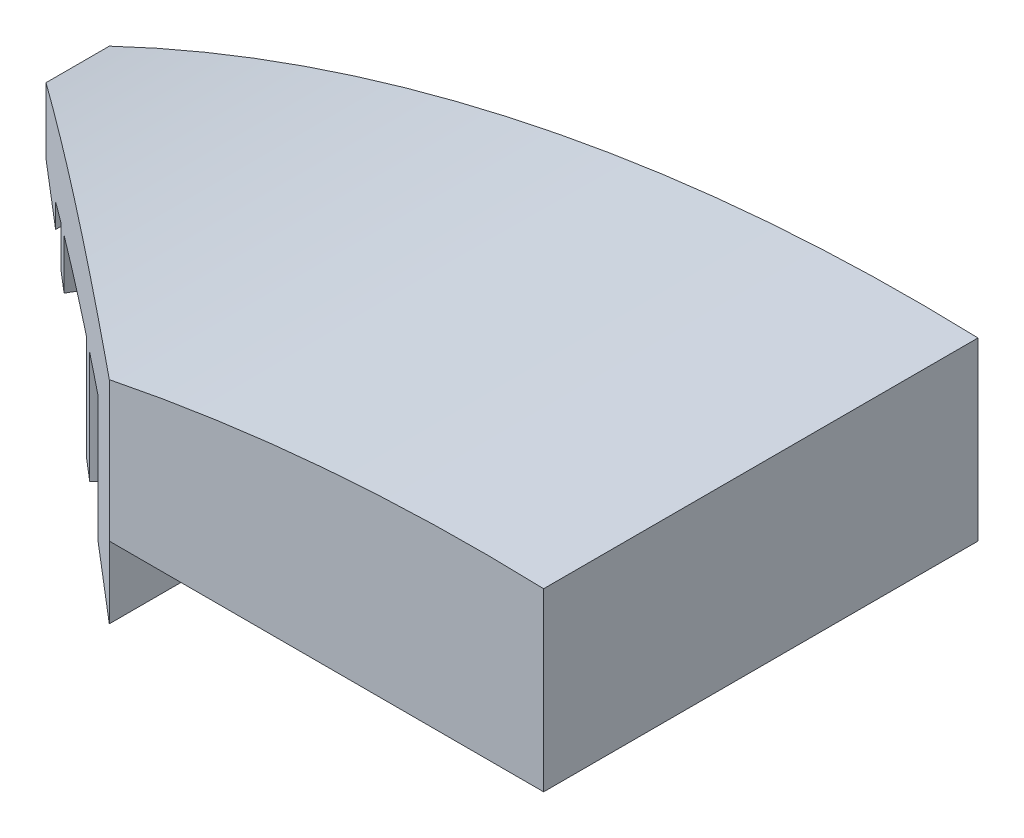
from build123d import *

# Parameters (mm, degrees)
BOSS_EXTRUDE1_DEPTH      = 3.95
SHELL1_START             = -2.75
SHELL1_DEPTH             = 5.5
BOSS_EXTRUDE2_REACH      = 11.943
BOSS_EXTRUDE2_END_RADIUS = 32.700000868
BOSS_EXTRUDE2_START      = 0.02
SKETCH2_R                = 2.4
SKETCH2_R_2              = 1.9
SKETCH3_W                = 6.823927471
SKETCH3_H                = 5.581929969
CUT_EXTRUDE1_DEPTH       = 2.4
BOSS_EXTRUDE3_REACH      = 11.601
BOSS_EXTRUDE3_START      = -0.2
SKETCH4_R                = 2.4
SKETCH4_R_2              = 1.9
CUT_EXTRUDE6_DEPTH       = 10.923471076
CUT_EXTRUDE6_DEPTH_BACK  = 10.923471076


# Read off the part's stored shape, not the designer's step: Shell1
with BuildPart() as part:
    # Sketch1 → Boss-Extrude1 (new, symmetric)
    with BuildSketch(Plane.XY):
        with BuildLine():
            Line((-7.9, 1.037208095), (0, 1.037208095))
            Line((0, 1.037208095), (0, 2.340892579))
            Line((0, 2.340892579), (7.9, 2.340892579))
            Line((7.9, 2.340892579), (7.9, 5.540892579))
            ThreePointArc((7.9, 5.540892579), (-0.199501968, 4.843176285), (-7.9, 2.237208095))
            Line((-7.9, 2.237208095), (-7.9, 1.037208095))
        make_face()
    extrude(amount=BOSS_EXTRUDE1_DEPTH, both=True)

    # Shell1 outline → Shell1 (cut)
    with BuildSketch(Plane.XY.offset(SHELL1_START)):
        with BuildLine():
            Line((-1.2, 1.037208095), (-1.2, 3.382492095))
            ThreePointArc((-1.2, 3.382492095), (-3.992613389, 2.549753458), (-6.7, 1.471699231))
            Line((-6.7, 1.471699231), (-6.7, 1.037208095))
            Line((-6.7, 1.037208095), (-1.2, 1.037208095))
        make_face()
        with BuildLine():
            ThreePointArc((6.7, 4.360765395), (3.058165542, 4.152993699), (-0.537868318, 3.540892579))
            Line((-0.537868318, 3.540892579), (6.7, 3.540892579))
            Line((6.7, 3.540892579), (6.7, 4.360765395))
        make_face()
    extrude(amount=SHELL1_DEPTH, mode=Mode.SUBTRACT)

    # Boss-Extrude2: up to this cylinder (the profile starts inside it)
    boss_extrude2_end = Plane(origin=(6.738734935, -28.339212532, 2.332118), z_dir=(0, 0, -1)) * Cylinder(BOSS_EXTRUDE2_END_RADIUS, 90.286001737, mode=Mode.PRIVATE)
    # Sketch2 → Boss-Extrude2 (add, up to the surface)
    with BuildSketch(Plane(origin=(0, 1.037208095, 0), x_dir=(-1, 0, 0), z_dir=(0, -1, 0)).offset(BOSS_EXTRUDE2_START), mode=Mode.PRIVATE) as boss_extrude2_sk1:
        with Locations(Location((3.95, 0, 0), (0, 0, 90))):
            Circle(SKETCH2_R)
        with Locations(Location((3.95, 0, 0), (0, 0, 90))):
            Circle(SKETCH2_R_2, mode=Mode.SUBTRACT)
    boss_extrude2_tool1 = extrude(boss_extrude2_sk1.sketch, amount=-BOSS_EXTRUDE2_REACH, mode=Mode.PRIVATE) & boss_extrude2_end
    add(boss_extrude2_tool1.solids().sort_by_distance((-3.95, 1.017208, 2.332118))[0])

    # Sketch3 → Cut-Extrude1 (cut)
    with BuildSketch(Plane.XZ.offset(-2.340892579)):
        with Locations((3.411963736, 0.021143674)):
            Rectangle(SKETCH3_W, SKETCH3_H)
    extrude(amount=-CUT_EXTRUDE1_DEPTH, mode=Mode.SUBTRACT)

    # Sketch4 → Boss-Extrude3 (add, up to next)
    with BuildSketch(Plane(origin=(0, 2.340892579, 0), x_dir=(-1, 0, 0), z_dir=(0, -1, 0)).offset(BOSS_EXTRUDE3_START), mode=Mode.PRIVATE) as boss_extrude3_sk1:
        with Locations(Location((-3.411963735, 0, 0), (0, 0, 90))):
            Circle(SKETCH4_R)
        with Locations(Location((-3.411963735, 0, 0), (0, 0, 90))):
            Circle(SKETCH4_R_2, mode=Mode.SUBTRACT)
    boss_extrude3_tool1 = extrude(boss_extrude3_sk1.sketch, amount=-BOSS_EXTRUDE3_REACH, mode=Mode.PRIVATE) - part.part
    add(boss_extrude3_tool1.solids().sort_by_distance((3.411964, 2.540893, 2.332118))[0])

    # Sketch10 → Cut-Extrude6 (cut, two sides: drawn at the far end of the back side and taken through both)
    with BuildSketch(Plane(origin=(0, 1.037208095, 0), x_dir=(-1, 0, 0), z_dir=(0, -1, 0)).offset(-CUT_EXTRUDE6_DEPTH_BACK)):
        Polygon((7.9, 2.798684465), (0, -3.95), (7.9, -3.95), align=None)
    extrude(amount=CUT_EXTRUDE6_DEPTH + CUT_EXTRUDE6_DEPTH_BACK, mode=Mode.SUBTRACT)


solid = part.part
